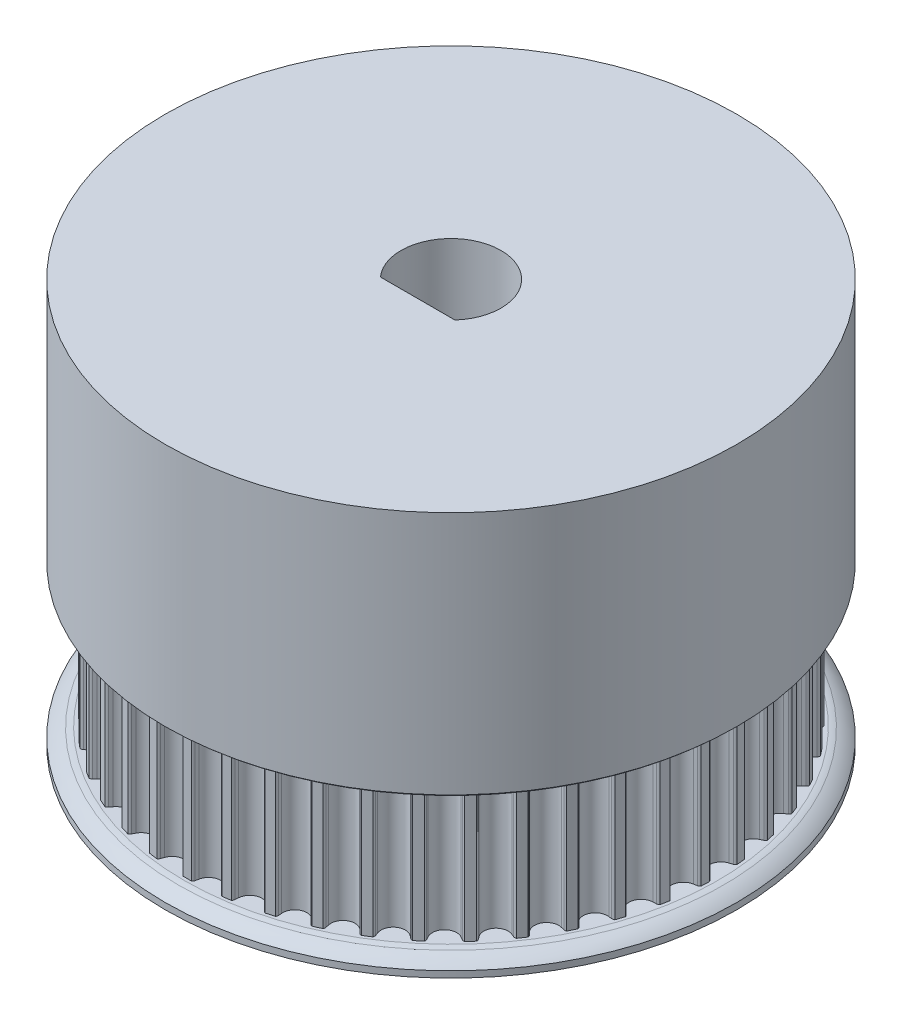
from build123d import *

# Parameters (mm, degrees)
SKETCH1_R               = 21.104918005
TOOTHOD_DEPTH           = 5.334
TOOTHPROFILE_DEPTH      = 31.31974083
TOOTHPATTERN_COUNT      = 45
SKETCH6_W               = 6.7056
SKETCH6_H               = 1.3335
BORE_DEPTH              = 34.320560906
BORE_DEPTH_BACK         = 34.320560906
LARGE_START             = 6.204
LARGE_TOOTH_COUNT_DEPTH = 0.4
CUT_EXTRUDE1_DEPTH      = 36.478318791
CUT_EXTRUDE1_DEPTH_BACK = 36.478318791
SKETCH12_R              = 19.072918005
SKETCH13_R              = 22.882918005
SKETCH13_R_2            = 19.072918005
BOSS_EXTRUDE1_DEPTH     = 12.7
SKETCH14_R              = 22.882918005
BOSS_EXTRUDE2_DEPTH     = 6.35
BOSS_EXTRUDE3_START     = 2.9972
SKETCH15_R              = 7.9375
SKETCH15_R_2            = 4
BOSS_EXTRUDE3_DEPTH     = 2.9972


# Read off the part's stored shape, not the designer's step: Large Tooth Count
with BuildPart() as part:
    # Sketch1 → ToothOD (new, symmetric)
    with BuildSketch(Plane(origin=(0, 0, 0), x_dir=(1, 0, 0), z_dir=(0, 1, 0))):
        with Locations(Location((0, 0, 0), (0, 0, 270))):
            Circle(SKETCH1_R)
    extrude(amount=TOOTHOD_DEPTH, both=True)

    # Sketch2 → ToothProfile (cut, symmetric)
    with BuildSketch(Plane(origin=(0, 0, 0), x_dir=(1, 0, 0), z_dir=(0, 1, 0))):
        with BuildLine():
            ThreePointArc((-0.937033068, 20.654980001), (-0.590385173, 20.136805391), (0, 19.936518005))
            ThreePointArc((0, 19.936518005), (0.590385173, 20.136805391), (0.937033068, 20.654980001))
            ThreePointArc((0.937033068, 20.654980001), (0.971699064, 20.781091463), (1.007805813, 20.906798005))
            ThreePointArc((1.007805813, 20.906798005), (1.055402987, 21.001945002), (1.133238716, 21.074471144))
            ThreePointArc((1.133238716, 21.074471144), (0, 21.104918005), (-1.133238716, 21.074471144))
            ThreePointArc((-1.133238716, 21.074471144), (-1.055402987, 21.001945002), (-1.007805813, 20.906798005))
            ThreePointArc((-1.007805813, 20.906798005), (-0.971699064, 20.781091463), (-0.937033068, 20.654980001))
        make_face()
    toothprofile = extrude(amount=TOOTHPROFILE_DEPTH, both=True, mode=Mode.SUBTRACT)

    # ToothPattern: ToothProfile ×45 about axis
    toothpattern_axis = Axis((0, 0, 0), (0, 1, 0))
    for i in range(1, TOOTHPATTERN_COUNT):
        add(toothprofile.rotate(toothpattern_axis, i * 360 / TOOTHPATTERN_COUNT), mode=Mode.SUBTRACT)

    # Sketch4 → Flange (revolve)
    with BuildSketch(Plane.XY, mode=Mode.PRIVATE) as flange_sk:
        with BuildLine():
            Line((0, -5.334), (21.358918005, -5.334))
            ThreePointArc((21.358918005, -5.334), (21.588564626, -5.369951298), (21.813990333, -5.426637424))
            ThreePointArc((21.813990333, -5.426637424), (22.38171891, -5.708197125), (22.882918005, -6.096))
            Line((22.882918005, -6.096), (22.882918005, -6.604))
            Line((22.882918005, -6.604), (0, -6.604))
            Line((0, -6.604), (0, -5.334))
        make_face()
        with BuildLine():
            Line((22.882918005, 6.604), (22.882918005, 6.096))
            ThreePointArc((22.882918005, 6.096), (22.38171891, 5.708197125), (21.813990333, 5.426637424))
            ThreePointArc((21.813990333, 5.426637424), (21.588564626, 5.369951298), (21.358918005, 5.334))
            Line((21.358918005, 5.334), (0, 5.334))
            Line((0, 5.334), (0, 6.604))
            Line((0, 6.604), (22.882918005, 6.604))
        make_face()
    revolve(flange_sk.sketch.rotate(Axis((0, 8.73125, 0), (0, -1, 0)), 90), axis=Axis((0, 8.73125, 0), (0, -1, 0)))

    # Sketch6 → TopBearingBoss (revolve)
    with BuildSketch(Plane.XY, mode=Mode.PRIVATE) as topbearingboss_sk:
        with Locations((3.3528, 7.27075)):
            Rectangle(SKETCH6_W, SKETCH6_H)
    topbearingboss = revolve(topbearingboss_sk.sketch.rotate(Axis((0, 8.73125, 0), (0, -1, 0)), 90), axis=Axis((0, 8.73125, 0), (0, -1, 0)))

    # BottomBearingBoss: TopBearingBoss across plane
    add(topbearingboss.mirror(Plane.ZX))

    # Sketch7 → Bore (cut, two sides: drawn at the far end of the back side and taken through both)
    with BuildSketch(Plane.XZ.offset(-BORE_DEPTH_BACK)):
        Polygon((2.771627702, 4.8006), (-2.771627702, 4.8006), (-5.543255405, 0), (-2.771627702, -4.8006), (2.771627702, -4.8006), (5.543255405, 0), align=None)
    extrude(amount=BORE_DEPTH + BORE_DEPTH_BACK, mode=Mode.SUBTRACT)

    # Large Tooth Count outline → Large Tooth Count (cut)
    # profile 1 of 2: a face of its own
    with BuildSketch(Plane(origin=(0, 0, 0), x_dir=(1, 0, 0), z_dir=(0, 1, 0)).offset(LARGE_START)):
        with BuildLine():
            add(Edge.make_bspline(
                [(4.147839844, 10.691415625), (4.140878549, 10.667465555), (4.127367632, 10.62098176), (4.089384028, 10.55946385), (4.039014722, 10.509374192), (3.977206054, 10.470560031), (3.904309588, 10.444094905), (3.82064812, 10.434309851), (3.727266716, 10.439431083), (3.663111616, 10.45295255), (3.629025, 10.460136719)],
                knots=[0, 0, 0, 0, 0.116249151, 0.225623627, 0.333929272, 0.445957174, 0.564444713, 0.693633414, 0.837222599, 1, 1, 1, 1], degree=3))
            add(Edge.make_bspline(
                [(3.779936719, 11.150401563), (3.81540104, 11.140995151), (3.881818348, 11.123378896), (3.970656755, 11.083421149), (4.043629964, 11.03745949), (4.099960334, 10.983086621), (4.139419541, 10.920363138), (4.159608955, 10.849420244), (4.164693672, 10.771426183), (4.15364375, 10.718968638), (4.147839844, 10.691415625)],
                knots=[0, 0, 0, 0, 0.163863906, 0.306883067, 0.433913402, 0.547827251, 0.654235127, 0.761224425, 0.874584552, 1, 1, 1, 1], degree=3))
            Line((3.779936719, 11.150401563), (2.234207812, 11.529913281))
            add(Edge.make_bspline(
                [(1.601092969, 11.178083594), (1.618154213, 11.215382865), (1.650300185, 11.285660351), (1.707697023, 11.37903625), (1.77193446, 11.451491855), (1.840600836, 11.508063541), (1.921658996, 11.543131496), (2.014801875, 11.558668608), (2.121271408, 11.553654199), (2.194805293, 11.538196279), (2.234207812, 11.529913281)],
                knots=[0, 0, 0, 0, 0.151086807, 0.284670469, 0.401986187, 0.506647946, 0.609769712, 0.723371087, 0.851770704, 1, 1, 1, 1], degree=3))
            Line((1.601092969, 11.178083594), (1.018877344, 9.869884375))
            add(Edge.make_bspline(
                [(0.938510156, 9.683253906), (0.940533128, 9.688933927), (0.947029678, 9.707174687), (0.964345165, 9.743329663), (0.987112385, 9.800708417), (1.007309807, 9.844693238), (1.018877344, 9.869884375)],
                knots=[0, 0, 0, 0, 0.088966911, 0.28570741, 0.59090791, 1, 1, 1, 1], degree=3))
            add(Edge.make_bspline(
                [(1.223367188, 9.261772656), (1.20038202, 9.268610014), (1.154965192, 9.282120079), (1.092846321, 9.318447462), (1.038175059, 9.366114109), (0.992419745, 9.423891761), (0.956770803, 9.487049507), (0.934660408, 9.552757873), (0.927457629, 9.619214607), (0.934822239, 9.661885795), (0.938510156, 9.683253906)],
                knots=[0, 0, 0, 0, 0.128135105, 0.253184585, 0.382091893, 0.514879098, 0.646269568, 0.768852753, 0.88425023, 1, 1, 1, 1], degree=3))
            add(Edge.make_bspline(
                [(2.337792187, 9.44483125), (2.298636995, 9.453924364), (2.226153473, 9.470757404), (2.12358855, 9.483297878), (2.036669755, 9.486307682), (1.960884796, 9.473281997), (1.887556619, 9.448552417), (1.803554519, 9.418301153), (1.704829089, 9.378909152), (1.597398528, 9.3328651), (1.489422443, 9.290382315), (1.389207906, 9.26242388), (1.300978085, 9.251001646), (1.247745708, 9.258389352), (1.223367188, 9.261772656)],
                knots=[0, 0, 0, 0, 0.104188332, 0.192871925, 0.26777209, 0.328828628, 0.391103323, 0.468284993, 0.560478861, 0.666735242, 0.771565335, 0.86109196, 0.936385096, 1, 1, 1, 1], degree=3))
            add(Edge.make_bspline(
                [(2.861964844, 8.392021094), (2.87178129, 8.437402889), (2.890769516, 8.525186168), (2.90387982, 8.655172029), (2.900297917, 8.777862848), (2.882605119, 8.892791557), (2.851585159, 8.999108539), (2.80841946, 9.095417795), (2.754801309, 9.182112496), (2.687500154, 9.255899529), (2.612686261, 9.320887025), (2.528410446, 9.373704451), (2.436681033, 9.416545889), (2.371144834, 9.43529133), (2.337792187, 9.44483125)],
                knots=[0, 0, 0, 0, 0.105237564, 0.20356397, 0.295400171, 0.38284517, 0.466569196, 0.545725582, 0.621566387, 0.696622195, 0.771297662, 0.84563682, 0.921441574, 1, 1, 1, 1], degree=3))
            add(Edge.make_bspline(
                [(1.890414844, 7.675860156), (1.927464401, 7.668220134), (1.999562595, 7.653352702), (2.108737186, 7.649708536), (2.214044003, 7.663505302), (2.315760419, 7.692290911), (2.412430698, 7.735766361), (2.501327716, 7.795297138), (2.584392352, 7.865844194), (2.658236726, 7.950718046), (2.72446995, 8.046548007), (2.781175694, 8.152627719), (2.828622055, 8.26836347), (2.850650984, 8.350061646), (2.861964844, 8.392021094)],
                knots=[0, 0, 0, 0, 0.083757927, 0.162992371, 0.240835024, 0.318338467, 0.396602369, 0.474757689, 0.554782406, 0.637536017, 0.723389115, 0.812556563, 0.903730737, 1, 1, 1, 1], degree=3))
            add(Edge.make_bspline(
                [(1.263550781, 8.409880469), (1.273727467, 8.36372223), (1.293568404, 8.273729986), (1.341704895, 8.14690526), (1.402404018, 8.031101477), (1.477622104, 7.928512645), (1.564080287, 7.839044344), (1.663070125, 7.766991451), (1.771877917, 7.710091184), (1.850628587, 7.687349609), (1.890414844, 7.675860156)],
                knots=[0, 0, 0, 0, 0.138507966, 0.270041558, 0.396606024, 0.520961271, 0.641988507, 0.760053028, 0.878774469, 1, 1, 1, 1], degree=3))
            add(Edge.make_bspline(
                [(0.967085156, 8.783141406), (0.986703084, 8.777597819), (1.025462252, 8.766645347), (1.078199978, 8.738147767), (1.125294343, 8.703081697), (1.166535926, 8.660270554), (1.200360331, 8.608588662), (1.227856228, 8.5492264), (1.249407291, 8.482274434), (1.258700462, 8.434707003), (1.263550781, 8.409880469)],
                knots=[0, 0, 0, 0, 0.120012968, 0.237109784, 0.351310589, 0.465632963, 0.58599266, 0.714104462, 0.850784556, 1, 1, 1, 1], degree=3))
            add(Edge.make_bspline(
                [(0.553640625, 8.543825781), (0.559317543, 8.562667553), (0.570811954, 8.60081767), (0.604826376, 8.651945775), (0.648334954, 8.699233357), (0.702193494, 8.739980178), (0.762546698, 8.774021743), (0.829062634, 8.791256163), (0.898193431, 8.797046093), (0.943658047, 8.787869792), (0.967085156, 8.783141406)],
                knots=[0, 0, 0, 0, 0.111497682, 0.225756349, 0.345693677, 0.476205411, 0.608899766, 0.737180555, 0.86457381, 1, 1, 1, 1], degree=3))
            add(Edge.make_bspline(
                [(1.738610156, 7.107039063), (1.69624534, 7.118301457), (1.613393763, 7.140326978), (1.49329463, 7.178529087), (1.381081339, 7.221929071), (1.276690764, 7.270831418), (1.179487302, 7.322669593), (1.090516301, 7.380452281), (1.008853303, 7.442032807), (0.912122387, 7.528582279), (0.809054852, 7.642181192), (0.706391238, 7.781733455), (0.629481862, 7.92339407), (0.580236902, 8.065424052), (0.551466451, 8.201405597), (0.536864432, 8.326628648), (0.534536687, 8.440398145), (0.547502341, 8.51059346), (0.553640625, 8.543825781)],
                knots=[0, 0, 0, 0, 0.063899038, 0.124965398, 0.183628775, 0.239150823, 0.292933013, 0.344086487, 0.393641399, 0.441892993, 0.533109134, 0.616694611, 0.693958841, 0.767107054, 0.835024278, 0.896169213, 0.950843755, 1, 1, 1, 1], degree=3))
            add(Edge.make_bspline(
                [(3.676352344, 8.254503906), (3.667248654, 8.219557987), (3.649268405, 8.150538025), (3.61516872, 8.049902693), (3.574540224, 7.95370553), (3.530362397, 7.860562174), (3.479925653, 7.771840258), (3.424514815, 7.68680301), (3.363617951, 7.605417498), (3.29791466, 7.527982009), (3.227258532, 7.455399303), (3.152032576, 7.38871397), (3.073842917, 7.326318665), (2.989621914, 7.27224016), (2.902533971, 7.221632172), (2.810172651, 7.178426413), (2.714450496, 7.139418769), (2.61459863, 7.107855539), (2.51222455, 7.081342155), (2.406966719, 7.064139834), (2.300294933, 7.05192331), (2.191335739, 7.048784747), (2.080687886, 7.052300903), (1.967986552, 7.063225577), (1.853421408, 7.080855671), (1.777212282, 7.098235617), (1.738610156, 7.107039063)],
                knots=[0, 0, 0, 0, 0.04289316, 0.084716164, 0.126089762, 0.166895789, 0.207116913, 0.247232193, 0.287403543, 0.327792204, 0.367802921, 0.407624105, 0.447167984, 0.486497833, 0.526411546, 0.566745989, 0.607524427, 0.64912559, 0.691065039, 0.733038764, 0.775721504, 0.818532956, 0.862404705, 0.9071625, 0.952975122, 1, 1, 1, 1], degree=3))
            add(Edge.make_bspline(
                [(2.669976563, 9.969003906), (2.715818024, 9.956546199), (2.806656877, 9.931860167), (2.936359205, 9.878790414), (3.057773276, 9.812879404), (3.17102185, 9.736155557), (3.275380892, 9.649710785), (3.369978949, 9.554365416), (3.45407199, 9.450365399), (3.527942311, 9.338719234), (3.592288642, 9.220581151), (3.642565217, 9.095045458), (3.682697606, 8.963741846), (3.708557962, 8.826905942), (3.723947465, 8.686181001), (3.7218955, 8.543211956), (3.708792218, 8.398203318), (3.687264359, 8.302841029), (3.676352344, 8.254503906)],
                knots=[0, 0, 0, 0, 0.064313133, 0.127442081, 0.189332678, 0.251185163, 0.312473738, 0.372641612, 0.432851366, 0.493360184, 0.553803119, 0.614760449, 0.676252997, 0.739523469, 0.803164266, 0.867688194, 0.932933951, 1, 1, 1, 1], degree=3))
            add(Edge.make_bspline(
                [(1.847552344, 9.936857031), (1.886153286, 9.946218365), (1.961475879, 9.964485276), (2.073949026, 9.984118258), (2.182478815, 9.997051565), (2.287318095, 10.006337837), (2.388479704, 10.005440593), (2.485689707, 10.000549825), (2.57959457, 9.989429618), (2.640008935, 9.975776385), (2.669976563, 9.969003906)],
                knots=[0, 0, 0, 0, 0.143345214, 0.279711649, 0.411777659, 0.537855907, 0.659265119, 0.776553952, 0.889162984, 1, 1, 1, 1], degree=3))
            Line((1.847552344, 9.936857031), (2.236886719, 10.80214375))
            Line((2.236886719, 10.80214375), (3.629025, 10.460136719))
        make_face()
    # profile 2 of 2: a face of its own
    with BuildSketch(Plane(origin=(0, 0, 0), x_dir=(1, 0, 0), z_dir=(0, 1, 0)).offset(LARGE_START)):
        with BuildLine():
            add(Edge.make_bspline(
                [(-1.01713446, 7.284577859), (-1.043802228, 7.279362263), (-1.095665021, 7.269219105), (-1.173763249, 7.27178998), (-1.24743336, 7.29129076), (-1.315912467, 7.326200885), (-1.3769481, 7.378323377), (-1.42739616, 7.447692895), (-1.468521297, 7.532429498), (-1.486368391, 7.595863084), (-1.49576571, 7.629263796)],
                knots=[0, 0, 0, 0, 0.121788613, 0.236851388, 0.347445526, 0.461666139, 0.579287629, 0.704442902, 0.844375543, 1, 1, 1, 1], degree=3))
            add(Edge.make_bspline(
                [(-0.75281571, 7.81232239), (-0.745596655, 7.777350987), (-0.732048649, 7.711720129), (-0.727342177, 7.616323567), (-0.740242284, 7.531216595), (-0.770275898, 7.457621836), (-0.813615871, 7.395071052), (-0.871380993, 7.346438844), (-0.938937018, 7.306521991), (-0.990473695, 7.292059527), (-1.01713446, 7.284577859)],
                knots=[0, 0, 0, 0, 0.159559114, 0.299444712, 0.424853657, 0.541292939, 0.652101353, 0.761558002, 0.876650058, 1, 1, 1, 1], degree=3))
            Line((-0.75281571, 7.81232239), (-0.884082116, 8.347210671))
            Line((-0.884082116, 8.347210671), (-0.705488366, 8.39096614))
            add(Edge.make_bspline(
                [(-0.336692273, 8.811554421), (-0.331667472, 8.785777812), (-0.322177999, 8.737097986), (-0.326328529, 8.66488606), (-0.348031636, 8.599957695), (-0.388841844, 8.543875381), (-0.444980456, 8.49520149), (-0.517192308, 8.453254773), (-0.605575963, 8.418060974), (-0.67074411, 8.400388292), (-0.705488366, 8.39096614)],
                knots=[0, 0, 0, 0, 0.123050033, 0.232383326, 0.335897326, 0.440295997, 0.554256217, 0.68284282, 0.830908334, 1, 1, 1, 1], degree=3))
            add(Edge.make_bspline(
                [(-0.912657116, 9.006221609), (-0.876751744, 9.014256187), (-0.808334129, 9.029566061), (-0.709119944, 9.042174733), (-0.619318961, 9.045479767), (-0.538783494, 9.038864642), (-0.46564489, 9.016662934), (-0.406014945, 8.968095092), (-0.36251543, 8.896985475), (-0.345759365, 8.84155119), (-0.336692273, 8.811554421)],
                knots=[0, 0, 0, 0, 0.15798138, 0.301033203, 0.428953253, 0.543331265, 0.647246611, 0.751883163, 0.865738261, 1, 1, 1, 1], degree=3))
            Line((-0.912657116, 9.006221609), (-1.03856571, 8.975860671))
            Line((-1.03856571, 8.975860671), (-1.600243054, 11.261860671))
            add(Edge.make_bspline(
                [(-2.177993835, 11.664589577), (-2.142156636, 11.671802257), (-2.074467161, 11.685425601), (-1.974541406, 11.685630378), (-1.884788312, 11.663635045), (-1.804163377, 11.622853246), (-1.736356248, 11.559349838), (-1.678520279, 11.47805802), (-1.632200281, 11.376959041), (-1.611336504, 11.301815266), (-1.600243054, 11.261860671)],
                knots=[0, 0, 0, 0, 0.135800351, 0.256500362, 0.368221777, 0.476679977, 0.588779376, 0.71016313, 0.845891233, 1, 1, 1, 1], degree=3))
            add(Edge.make_bspline(
                [(-2.572686023, 11.15559739), (-2.556512115, 11.193484119), (-2.526274512, 11.264314492), (-2.481123689, 11.362072768), (-2.438080565, 11.443661729), (-2.397978576, 11.512129289), (-2.354395141, 11.568129981), (-2.303284607, 11.612039139), (-2.243929348, 11.645031225), (-2.200335163, 11.657962503), (-2.177993835, 11.664589577)],
                knots=[0, 0, 0, 0, 0.184226765, 0.34441745, 0.481369461, 0.596657053, 0.698938334, 0.7971182, 0.8960263, 1, 1, 1, 1], degree=3))
            Line((-2.572686023, 11.15559739), (-3.61745946, 8.699040359))
            add(Edge.make_bspline(
                [(-3.770157116, 8.134684109), (-3.773437174, 8.153671921), (-3.780117964, 8.192346115), (-3.778865983, 8.254014587), (-3.766207521, 8.31948607), (-3.745709718, 8.388881105), (-3.718712282, 8.459085318), (-3.689882705, 8.532458702), (-3.655609261, 8.611980238), (-3.630887268, 8.668397299), (-3.61745946, 8.699040359)],
                knots=[0, 0, 0, 0, 0.097140894, 0.197855633, 0.309303619, 0.432973572, 0.562801576, 0.688958287, 0.831056964, 1, 1, 1, 1], degree=3))
            add(Edge.make_bspline(
                [(-3.098644616, 7.803392702), (-3.142496502, 7.794061751), (-3.225143368, 7.776475874), (-3.34563061, 7.77108404), (-3.453305397, 7.786490653), (-3.547446979, 7.822516281), (-3.626974041, 7.877423315), (-3.691524892, 7.948655369), (-3.740898292, 8.035728174), (-3.760150464, 8.100840725), (-3.770157116, 8.134684109)],
                knots=[0, 0, 0, 0, 0.158011373, 0.297801213, 0.42317139, 0.539224647, 0.650225018, 0.761006532, 0.875778978, 1, 1, 1, 1], degree=3))
            Line((-3.098644616, 7.803392702), (-1.627032116, 8.164152077))
            Line((-1.627032116, 8.164152077), (-1.49576571, 7.629263796))
        make_face()
        Polygon((-1.78151571, 8.792802077), (-3.041494616, 8.48383489), (-2.20299696, 10.507302077), align=None, mode=Mode.SUBTRACT)
    extrude(amount=LARGE_TOOTH_COUNT_DEPTH, mode=Mode.SUBTRACT)

    # Sketch12 → Cut-Extrude1 (cut, two sides: drawn at the far end of the back side and taken through both)
    with BuildSketch(Plane(origin=(0, 6.604, 0), x_dir=(1, 0, 0), z_dir=(0, 1, 0)).offset(-CUT_EXTRUDE1_DEPTH_BACK)):
        with Locations(Location((0, 0, 0), (0, 0, 270))):
            Circle(SKETCH12_R)
    extrude(amount=CUT_EXTRUDE1_DEPTH + CUT_EXTRUDE1_DEPTH_BACK, mode=Mode.SUBTRACT)

    # Sketch13 → Boss-Extrude1 (add)
    with BuildSketch(Plane(origin=(0, 6.604, 0), x_dir=(1, 0, 0), z_dir=(0, 1, 0))):
        with Locations(Location((0, 0, 0), (0, 0, 270))):
            Circle(SKETCH13_R)
        with Locations(Location((0, 0, 0), (0, 0, 270))):
            Circle(SKETCH13_R_2, mode=Mode.SUBTRACT)
    extrude(amount=BOSS_EXTRUDE1_DEPTH)

    # Sketch14 → Boss-Extrude2 (add)
    with BuildSketch(Plane(origin=(0, 19.304, 0), x_dir=(1, 0, 0), z_dir=(0, 1, 0))):
        with Locations(Location((0, 0, 0), (0, 0, 270))):
            Circle(SKETCH14_R)
        with BuildLine():
            Line((-2.981125794, -2.667), (2.981125794, -2.667))
            ThreePointArc((2.981125794, -2.667), (0, 4), (-2.981125794, -2.667))
        make_face(mode=Mode.SUBTRACT)
    extrude(amount=BOSS_EXTRUDE2_DEPTH)

    # Sketch15 → Boss-Extrude3 (add)
    with BuildSketch(Plane.XZ.offset(-19.304).offset(BOSS_EXTRUDE3_START)):
        with Locations(Location((0, 0, 0), (0, 0, 90))):
            Circle(SKETCH15_R)
        with Locations(Location((0, 0, 0), (0, 0, 270))):
            Circle(SKETCH15_R_2, mode=Mode.SUBTRACT)
    extrude(amount=-BOSS_EXTRUDE3_DEPTH)


solid = part.part
